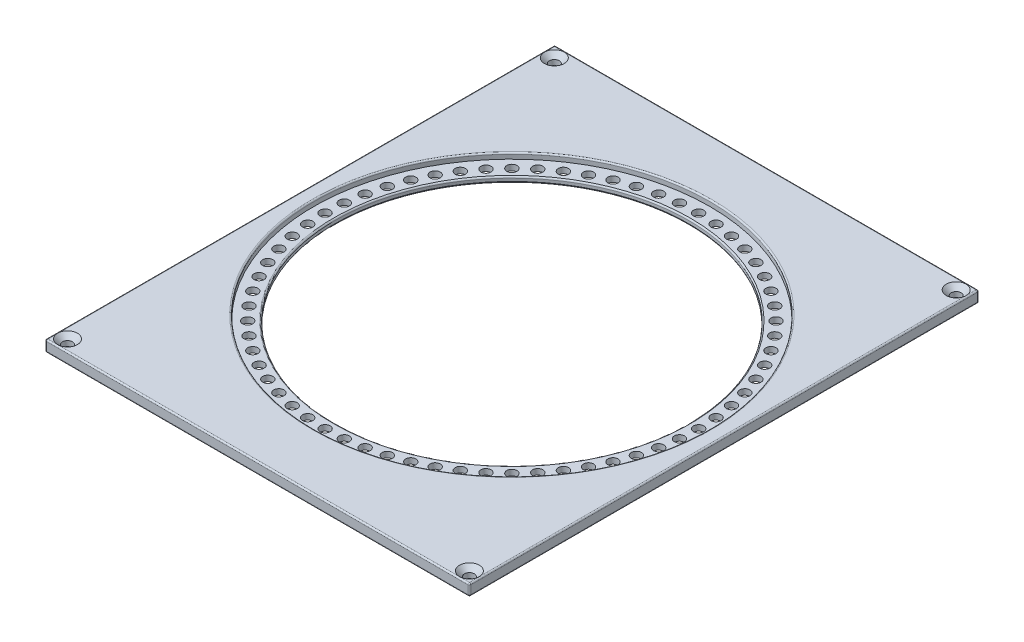
from build123d import *

# Parameters (mm, degrees)
SKETCH1_R           = 70
SKETCH1_R_2         = 62.5
SKETCH1_R_3         = 1.8
BOSS_EXTRUDE1_DEPTH = 2
SKETCH1_3_W         = 150
SKETCH1_3_H         = 180
SKETCH1_3_R         = 70
SKETCH1_3_R_2       = 1.75
BOSS_EXTRUDE2_DEPTH = 4
SKETCH2_W           = 180
SKETCH2_H           = 4
CUT_EXTRUDE1_DEPTH  = 0.1
CHAMFER1_SIZE       = 1.75
BOSS_EXTRUDE3_DEPTH = 2
FILLET1_R           = 0.5


with BuildPart() as part:
    # Sketch1 → Boss-Extrude1 (new body)
    with BuildSketch(Plane(origin=(0, 0, 0), x_dir=(1, 0, 0), z_dir=(0, 1, 0))):
        with Locations(Location((0, 0, 0), (0, 0, 270))):
            Circle(SKETCH1_R)
        with Locations(Location((0, 0, 0), (0, 0, 270))):
            Circle(SKETCH1_R_2, mode=Mode.SUBTRACT)
        with Locations(Location((46.669047558, -46.669047558, 0), (0, 0, 270))):
            Circle(SKETCH1_R_3, mode=Mode.SUBTRACT)
        with Locations(Location((41.869956755, -51.018689922, 0), (0, 0, 270))):
            Circle(SKETCH1_R_3, mode=Mode.SUBTRACT)
        with Locations(Location((36.667635379, -54.876994412, 0), (0, 0, 270))):
            Circle(SKETCH1_R_3, mode=Mode.SUBTRACT)
        with Locations(Location((31.112184631, -58.206803447, 0), (0, 0, 270))):
            Circle(SKETCH1_R_3, mode=Mode.SUBTRACT)
        with Locations(Location((25.257106536, -60.976049146, 0), (0, 0, 270))):
            Circle(SKETCH1_R_3, mode=Mode.SUBTRACT)
        with Locations(Location((19.158788699, -63.158062158, 0), (0, 0, 270))):
            Circle(SKETCH1_R_3, mode=Mode.SUBTRACT)
        with Locations(Location((12.875961253, -64.731828507, 0), (0, 0, 270))):
            Circle(SKETCH1_R_3, mode=Mode.SUBTRACT)
        with Locations(Location((6.469131262, -65.68219196, 0), (0, 0, 270))):
            Circle(SKETCH1_R_3, mode=Mode.SUBTRACT)
        with Locations(Location((0, -66, 0), (0, 0, 270))):
            Circle(SKETCH1_R_3, mode=Mode.SUBTRACT)
        with Locations(Location((-6.469131262, -65.68219196, 0), (0, 0, 270))):
            Circle(SKETCH1_R_3, mode=Mode.SUBTRACT)
        with Locations(Location((-12.875961253, -64.731828507, 0), (0, 0, 270))):
            Circle(SKETCH1_R_3, mode=Mode.SUBTRACT)
        with Locations(Location((-19.158788699, -63.158062158, 0), (0, 0, 270))):
            Circle(SKETCH1_R_3, mode=Mode.SUBTRACT)
        with Locations(Location((-25.257106536, -60.976049146, 0), (0, 0, 270))):
            Circle(SKETCH1_R_3, mode=Mode.SUBTRACT)
        with Locations(Location((-31.112184631, -58.206803447, 0), (0, 0, 270))):
            Circle(SKETCH1_R_3, mode=Mode.SUBTRACT)
        with Locations(Location((-36.667635379, -54.876994412, 0), (0, 0, 270))):
            Circle(SKETCH1_R_3, mode=Mode.SUBTRACT)
        with Locations(Location((-41.869956755, -51.018689922, 0), (0, 0, 270))):
            Circle(SKETCH1_R_3, mode=Mode.SUBTRACT)
        with Locations(Location((-46.669047558, -46.669047558, 0), (0, 0, 270))):
            Circle(SKETCH1_R_3, mode=Mode.SUBTRACT)
        with Locations(Location((-51.018689922, -41.869956755, 0), (0, 0, 270))):
            Circle(SKETCH1_R_3, mode=Mode.SUBTRACT)
        with Locations(Location((-54.876994412, -36.667635379, 0), (0, 0, 270))):
            Circle(SKETCH1_R_3, mode=Mode.SUBTRACT)
        with Locations(Location((-58.206803447, -31.112184631, 0), (0, 0, 270))):
            Circle(SKETCH1_R_3, mode=Mode.SUBTRACT)
        with Locations(Location((-60.976049146, -25.257106536, 0), (0, 0, 270))):
            Circle(SKETCH1_R_3, mode=Mode.SUBTRACT)
        with Locations(Location((-63.158062158, -19.158788699, 0), (0, 0, 270))):
            Circle(SKETCH1_R_3, mode=Mode.SUBTRACT)
        with Locations(Location((-64.731828507, -12.875961253, 0), (0, 0, 270))):
            Circle(SKETCH1_R_3, mode=Mode.SUBTRACT)
        with Locations(Location((-65.68219196, -6.469131262, 0), (0, 0, 270))):
            Circle(SKETCH1_R_3, mode=Mode.SUBTRACT)
        with Locations(Location((-66, 0, 0), (0, 0, 270))):
            Circle(SKETCH1_R_3, mode=Mode.SUBTRACT)
        with Locations(Location((-65.68219196, 6.469131262, 0), (0, 0, 270))):
            Circle(SKETCH1_R_3, mode=Mode.SUBTRACT)
        with Locations(Location((-64.731828507, 12.875961253, 0), (0, 0, 270))):
            Circle(SKETCH1_R_3, mode=Mode.SUBTRACT)
        with Locations(Location((-63.158062158, 19.158788699, 0), (0, 0, 270))):
            Circle(SKETCH1_R_3, mode=Mode.SUBTRACT)
        with Locations(Location((-60.976049146, 25.257106536, 0), (0, 0, 270))):
            Circle(SKETCH1_R_3, mode=Mode.SUBTRACT)
        with Locations(Location((-58.206803447, 31.112184631, 0), (0, 0, 270))):
            Circle(SKETCH1_R_3, mode=Mode.SUBTRACT)
        with Locations(Location((-54.876994412, 36.667635379, 0), (0, 0, 270))):
            Circle(SKETCH1_R_3, mode=Mode.SUBTRACT)
        with Locations(Location((-51.018689922, 41.869956755, 0), (0, 0, 270))):
            Circle(SKETCH1_R_3, mode=Mode.SUBTRACT)
        with Locations(Location((-46.669047558, 46.669047558, 0), (0, 0, 270))):
            Circle(SKETCH1_R_3, mode=Mode.SUBTRACT)
        with Locations(Location((-41.869956755, 51.018689922, 0), (0, 0, 270))):
            Circle(SKETCH1_R_3, mode=Mode.SUBTRACT)
        with Locations(Location((-36.667635379, 54.876994412, 0), (0, 0, 270))):
            Circle(SKETCH1_R_3, mode=Mode.SUBTRACT)
        with Locations(Location((-31.112184631, 58.206803447, 0), (0, 0, 270))):
            Circle(SKETCH1_R_3, mode=Mode.SUBTRACT)
        with Locations(Location((-25.257106536, 60.976049146, 0), (0, 0, 270))):
            Circle(SKETCH1_R_3, mode=Mode.SUBTRACT)
        with Locations(Location((-19.158788699, 63.158062158, 0), (0, 0, 270))):
            Circle(SKETCH1_R_3, mode=Mode.SUBTRACT)
        with Locations(Location((-12.875961253, 64.731828507, 0), (0, 0, 270))):
            Circle(SKETCH1_R_3, mode=Mode.SUBTRACT)
        with Locations(Location((-6.469131262, 65.68219196, 0), (0, 0, 270))):
            Circle(SKETCH1_R_3, mode=Mode.SUBTRACT)
        with Locations(Location((0, 66, 0), (0, 0, 270))):
            Circle(SKETCH1_R_3, mode=Mode.SUBTRACT)
        with Locations(Location((6.469131262, 65.68219196, 0), (0, 0, 270))):
            Circle(SKETCH1_R_3, mode=Mode.SUBTRACT)
        with Locations(Location((12.875961253, 64.731828507, 0), (0, 0, 270))):
            Circle(SKETCH1_R_3, mode=Mode.SUBTRACT)
        with Locations(Location((19.158788699, 63.158062158, 0), (0, 0, 270))):
            Circle(SKETCH1_R_3, mode=Mode.SUBTRACT)
        with Locations(Location((25.257106536, 60.976049146, 0), (0, 0, 270))):
            Circle(SKETCH1_R_3, mode=Mode.SUBTRACT)
        with Locations(Location((31.112184631, 58.206803447, 0), (0, 0, 270))):
            Circle(SKETCH1_R_3, mode=Mode.SUBTRACT)
        with Locations(Location((36.667635379, 54.876994412, 0), (0, 0, 270))):
            Circle(SKETCH1_R_3, mode=Mode.SUBTRACT)
        with Locations(Location((41.869956755, 51.018689922, 0), (0, 0, 270))):
            Circle(SKETCH1_R_3, mode=Mode.SUBTRACT)
        with Locations(Location((46.669047558, 46.669047558, 0), (0, 0, 270))):
            Circle(SKETCH1_R_3, mode=Mode.SUBTRACT)
        with Locations(Location((51.018689922, 41.869956755, 0), (0, 0, 270))):
            Circle(SKETCH1_R_3, mode=Mode.SUBTRACT)
        with Locations(Location((54.876994412, 36.667635379, 0), (0, 0, 270))):
            Circle(SKETCH1_R_3, mode=Mode.SUBTRACT)
        with Locations(Location((58.206803447, 31.112184631, 0), (0, 0, 270))):
            Circle(SKETCH1_R_3, mode=Mode.SUBTRACT)
        with Locations(Location((60.976049146, 25.257106536, 0), (0, 0, 270))):
            Circle(SKETCH1_R_3, mode=Mode.SUBTRACT)
        with Locations(Location((63.158062158, 19.158788699, 0), (0, 0, 270))):
            Circle(SKETCH1_R_3, mode=Mode.SUBTRACT)
        with Locations(Location((64.731828507, 12.875961253, 0), (0, 0, 270))):
            Circle(SKETCH1_R_3, mode=Mode.SUBTRACT)
        with Locations(Location((65.68219196, 6.469131262, 0), (0, 0, 270))):
            Circle(SKETCH1_R_3, mode=Mode.SUBTRACT)
        with Locations(Location((66, 0, 0), (0, 0, 270))):
            Circle(SKETCH1_R_3, mode=Mode.SUBTRACT)
        with Locations(Location((65.68219196, -6.469131262, 0), (0, 0, 270))):
            Circle(SKETCH1_R_3, mode=Mode.SUBTRACT)
        with Locations(Location((64.731828507, -12.875961253, 0), (0, 0, 270))):
            Circle(SKETCH1_R_3, mode=Mode.SUBTRACT)
        with Locations(Location((63.158062158, -19.158788699, 0), (0, 0, 270))):
            Circle(SKETCH1_R_3, mode=Mode.SUBTRACT)
        with Locations(Location((60.976049146, -25.257106536, 0), (0, 0, 270))):
            Circle(SKETCH1_R_3, mode=Mode.SUBTRACT)
        with Locations(Location((58.206803447, -31.112184631, 0), (0, 0, 270))):
            Circle(SKETCH1_R_3, mode=Mode.SUBTRACT)
        with Locations(Location((54.876994412, -36.667635379, 0), (0, 0, 270))):
            Circle(SKETCH1_R_3, mode=Mode.SUBTRACT)
        with Locations(Location((51.018689922, -41.869956755, 0), (0, 0, 270))):
            Circle(SKETCH1_R_3, mode=Mode.SUBTRACT)
    extrude(amount=BOSS_EXTRUDE1_DEPTH)

    # Sketch1<3> → Boss-Extrude2 (add)
    with BuildSketch(Plane(origin=(0, 0, 0), x_dir=(1, 0, 0), z_dir=(0, 1, 0))):
        Rectangle(SKETCH1_3_W, SKETCH1_3_H)
        with Locations(Location((0, 0, 0), (0, 0, 270))):
            Circle(SKETCH1_3_R, mode=Mode.SUBTRACT)
        with Locations(Location((-71, 86, 0), (0, 0, 270))):
            Circle(SKETCH1_3_R_2, mode=Mode.SUBTRACT)
        with Locations(Location((71, 86, 0), (0, 0, 270))):
            Circle(SKETCH1_3_R_2, mode=Mode.SUBTRACT)
        with Locations(Location((71, -86, 0), (0, 0, 270))):
            Circle(SKETCH1_3_R_2, mode=Mode.SUBTRACT)
        with Locations(Location((-71, -86, 0), (0, 0, 270))):
            Circle(SKETCH1_3_R_2, mode=Mode.SUBTRACT)
    extrude(amount=BOSS_EXTRUDE2_DEPTH)

    # Sketch2 → Cut-Extrude1 (cut)
    with BuildSketch(Plane.ZY.offset(75)):
        with Locations((0, 2)):
            Rectangle(SKETCH2_W, SKETCH2_H)
    extrude(amount=-CUT_EXTRUDE1_DEPTH, mode=Mode.SUBTRACT)

    # Chamfer1
    chamfer1_edges = [part.edges().sort_by_distance(p)[0] for p in [
        (-71, 4, -87.75),
        (71, 4, -87.75),
        (71, 4, 84.25),
        (-71, 4, 84.25),
    ]]
    chamfer(chamfer1_edges, length=CHAMFER1_SIZE)

    # Sketch1<4> → Boss-Extrude3 (add)
    with BuildSketch(Plane(origin=(0, 0, 0), x_dir=(1, 0, 0), z_dir=(0, 1, 0))):
        Polygon((-72.7, 0), (-72.7, 10), (-70.147780835, 10), (-70.147780835, -10), (-72.7, -10), align=None)
        Polygon((0, -87.7), (-10, -87.7), (-10, -85.7), (10, -85.7), (10, -87.7), align=None)
        Polygon((0, 87.7), (10, 87.7), (10, 85.7), (-10, 85.7), (-10, 87.7), align=None)
    extrude(amount=-BOSS_EXTRUDE3_DEPTH)

    # Fillet1
    # the kernel refuses this fillet: 0.5 mm, written as the material it takes off along each edge
    with BuildSketch(Plane(origin=(74.5, 3.5, 89.5), x_dir=(0, 0, 1), z_dir=(0, 1, 0))) as fillet1_piece_1_section:
        Polygon((0, 0), (FILLET1_R, 0), (FILLET1_R, FILLET1_R), (0, FILLET1_R), align=None)
    fillet1_piece_1 = extrude(amount=FILLET1_R, mode=Mode.PRIVATE)
    fillet1_piece_1 = fillet1_piece_1 - Plane(origin=(74.5, 3.5, 89.5), x_dir=(-0.7071067811865476, 0, -0.7071067811865476), z_dir=(0, 1, 0)) * Sphere(FILLET1_R, mode=Mode.PRIVATE)
    add(fillet1_piece_1, mode=Mode.SUBTRACT)
    with BuildSketch(Plane(origin=(-74.4, 3.5, 89.5), x_dir=(0, 0, 1), z_dir=(0, 1, 0))) as fillet1_piece_2_section:
        Polygon((0, 0), (FILLET1_R, 0), (FILLET1_R, -FILLET1_R), (0, -FILLET1_R), align=None)
    fillet1_piece_2 = extrude(amount=FILLET1_R, mode=Mode.PRIVATE)
    fillet1_piece_2 = fillet1_piece_2 - Plane(origin=(-74.4, 3.5, 89.5), x_dir=(0.7071067811865474, 0, -0.7071067811865476), z_dir=(0, 1, 0)) * Sphere(FILLET1_R, mode=Mode.PRIVATE)
    add(fillet1_piece_2, mode=Mode.SUBTRACT)
    with BuildSketch(Plane(origin=(74.5, 0.5, -89.5), x_dir=(1, 0, 0), z_dir=(0, -1, 0))) as fillet1_piece_3_section:
        Polygon((0, 0), (FILLET1_R, 0), (FILLET1_R, -FILLET1_R), (0, -FILLET1_R), align=None)
    fillet1_piece_3 = extrude(amount=FILLET1_R, mode=Mode.PRIVATE)
    fillet1_piece_3 = fillet1_piece_3 - Plane(origin=(74.5, 0.5, -89.5), x_dir=(-0.7071067811865477, 0, 0.7071067811865474), z_dir=(0, -1, 0)) * Sphere(FILLET1_R, mode=Mode.PRIVATE)
    add(fillet1_piece_3, mode=Mode.SUBTRACT)
    with BuildSketch(Plane(origin=(74.5, 0.5, 89.5), x_dir=(0, 0, 1), z_dir=(0, -1, 0))) as fillet1_piece_4_section:
        Polygon((0, 0), (FILLET1_R, 0), (FILLET1_R, -FILLET1_R), (0, -FILLET1_R), align=None)
    fillet1_piece_4 = extrude(amount=FILLET1_R, mode=Mode.PRIVATE)
    fillet1_piece_4 = fillet1_piece_4 - Plane(origin=(74.5, 0.5, 89.5), x_dir=(-0.7071067811865476, 0, -0.7071067811865476), z_dir=(0, -1, 0)) * Sphere(FILLET1_R, mode=Mode.PRIVATE)
    add(fillet1_piece_4, mode=Mode.SUBTRACT)
    with BuildSketch(Plane(origin=(-74.4, 0.5, -89.5), x_dir=(-1, 0, 0), z_dir=(0, -1, 0))) as fillet1_piece_5_section:
        Polygon((0, 0), (FILLET1_R, 0), (FILLET1_R, FILLET1_R), (0, FILLET1_R), align=None)
    fillet1_piece_5 = extrude(amount=FILLET1_R, mode=Mode.PRIVATE)
    fillet1_piece_5 = fillet1_piece_5 - Plane(origin=(-74.4, 0.5, -89.5), x_dir=(0.7071067811865475, 0, 0.7071067811865476), z_dir=(0, -1, 0)) * Sphere(FILLET1_R, mode=Mode.PRIVATE)
    add(fillet1_piece_5, mode=Mode.SUBTRACT)
    with BuildSketch(Plane(origin=(74.5, 3.5, -89.5), x_dir=(1, 0, 0), z_dir=(0, 1, 0))) as fillet1_piece_6_section:
        Polygon((0, 0), (FILLET1_R, 0), (FILLET1_R, FILLET1_R), (0, FILLET1_R), align=None)
    fillet1_piece_6 = extrude(amount=FILLET1_R, mode=Mode.PRIVATE)
    fillet1_piece_6 = fillet1_piece_6 - Plane(origin=(74.5, 3.5, -89.5), x_dir=(-0.7071067811865477, 0, 0.7071067811865474), z_dir=(0, 1, 0)) * Sphere(FILLET1_R, mode=Mode.PRIVATE)
    add(fillet1_piece_6, mode=Mode.SUBTRACT)
    with BuildSketch(Plane(origin=(-74.4, 0.5, 89.5), x_dir=(0, 0, 1), z_dir=(0, -1, 0))) as fillet1_piece_7_section:
        Polygon((0, 0), (FILLET1_R, 0), (FILLET1_R, FILLET1_R), (0, FILLET1_R), align=None)
    fillet1_piece_7 = extrude(amount=FILLET1_R, mode=Mode.PRIVATE)
    fillet1_piece_7 = fillet1_piece_7 - Plane(origin=(-74.4, 0.5, 89.5), x_dir=(0.7071067811865474, 0, -0.7071067811865476), z_dir=(0, -1, 0)) * Sphere(FILLET1_R, mode=Mode.PRIVATE)
    add(fillet1_piece_7, mode=Mode.SUBTRACT)
    with BuildSketch(Plane(origin=(-74.4, 3.5, -89.5), x_dir=(-1, 0, 0), z_dir=(0, 1, 0))) as fillet1_piece_8_section:
        Polygon((0, 0), (FILLET1_R, 0), (FILLET1_R, -FILLET1_R), (0, -FILLET1_R), align=None)
    fillet1_piece_8 = extrude(amount=FILLET1_R, mode=Mode.PRIVATE)
    fillet1_piece_8 = fillet1_piece_8 - Plane(origin=(-74.4, 3.5, -89.5), x_dir=(0.7071067811865475, 0, 0.7071067811865476), z_dir=(0, 1, 0)) * Sphere(FILLET1_R, mode=Mode.PRIVATE)
    add(fillet1_piece_8, mode=Mode.SUBTRACT)
    with BuildSketch(Plane(origin=(74.5, 4, 90), x_dir=(0, 0, -1), z_dir=(-1, 0, 0)), Plane(origin=(-74.4, 4, -90), x_dir=(0, 0, 1), z_dir=(1, 0, 0))) as fillet1_piece_9:
        with BuildLine():
            CenterArc((FILLET1_R, FILLET1_R), FILLET1_R, 180, 90)
            Line((0, FILLET1_R), (0, 0))
            Line((0, 0), (FILLET1_R, 0))
        make_face()
    extrude(amount=148.9, mode=Mode.SUBTRACT)
    with BuildSketch(Plane(origin=(75, 0, -89.5), x_dir=(-1, 0, 0), z_dir=(0, 0, 1)), Plane(origin=(-74.9, 4, -89.5), x_dir=(1, 0, 0), z_dir=(0, 0, 1)), Plane(origin=(-74.9, 0, 89.5), x_dir=(1, 0, 0), z_dir=(0, 0, -1))) as fillet1_piece_10:
        with BuildLine():
            CenterArc((FILLET1_R, -FILLET1_R), FILLET1_R, 90, 90)
            Line((0, -FILLET1_R), (0, 0))
            Line((0, 0), (FILLET1_R, 0))
        make_face()
    extrude(amount=179, mode=Mode.SUBTRACT)
    with BuildSketch(Plane(origin=(75, 0.5, 90), x_dir=(-1, 0, 0), z_dir=(0, 1, 0)), Plane(origin=(75, 0.5, -90), x_dir=(0, 0, 1), z_dir=(0, 1, 0)), Plane(origin=(-74.9, 3.5, 90), x_dir=(1, 0, 0), z_dir=(0, -1, 0))) as fillet1_piece_11:
        with BuildLine():
            CenterArc((FILLET1_R, -FILLET1_R), FILLET1_R, 90, 90)
            Line((0, -FILLET1_R), (0, 0))
            Line((0, 0), (FILLET1_R, 0))
        make_face()
    extrude(amount=3, mode=Mode.SUBTRACT)
    with BuildSketch(Plane(origin=(-74.4, 0, -90), x_dir=(0, 0, 1), z_dir=(1, 0, 0)), Plane(origin=(74.5, 0, 90), x_dir=(0, 0, -1), z_dir=(-1, 0, 0))) as fillet1_piece_12:
        with BuildLine():
            CenterArc((FILLET1_R, -FILLET1_R), FILLET1_R, 90, 90)
            Line((0, -FILLET1_R), (0, 0))
            Line((0, 0), (FILLET1_R, 0))
        make_face()
    extrude(amount=148.9, mode=Mode.SUBTRACT)
    with BuildSketch(Plane(origin=(0, 4, 0), x_dir=(0, 0, 1), z_dir=(-1, 0, 0))) as fillet1_piece_13:
        with BuildLine():
            CenterArc((70 + FILLET1_R, -FILLET1_R), FILLET1_R, 90, 90)
            Line((70, -FILLET1_R), (70, 0))
            Line((70, 0), (70 + FILLET1_R, 0))
        make_face()
    revolve(axis=Axis((0, 4, 0), (0, 1, 0)), mode=Mode.SUBTRACT)
    with BuildSketch(Plane(origin=(-71, 0, 86), x_dir=(0, 0, 1), z_dir=(-1, 0, 0))) as fillet1_piece_14:
        with BuildLine():
            CenterArc((1.75 + FILLET1_R, FILLET1_R), FILLET1_R, 180, 90)
            Line((1.75 + FILLET1_R, 0), (1.75, 0))
            Line((1.75, 0), (1.75, FILLET1_R))
        make_face()
    revolve(axis=Axis((-71, 0, 86), (0, 1, 0)), mode=Mode.SUBTRACT)
    with BuildSketch(Plane(origin=(71, 0, 86), x_dir=(0, 0, 1), z_dir=(-1, 0, 0))) as fillet1_piece_15:
        with BuildLine():
            CenterArc((1.75 + FILLET1_R, FILLET1_R), FILLET1_R, 180, 90)
            Line((1.75, FILLET1_R), (1.75, 0))
            Line((1.75, 0), (1.75 + FILLET1_R, 0))
        make_face()
    revolve(axis=Axis((71, 0, 86), (0, 1, 0)), mode=Mode.SUBTRACT)
    with BuildSketch(Plane(origin=(71, 0, -86), x_dir=(0, 0, 1), z_dir=(-1, 0, 0))) as fillet1_piece_16:
        with BuildLine():
            CenterArc((1.75 + FILLET1_R, FILLET1_R), FILLET1_R, 180, 90)
            Line((1.75, FILLET1_R), (1.75, 0))
            Line((1.75, 0), (1.75 + FILLET1_R, 0))
        make_face()
    revolve(axis=Axis((71, 0, -86), (0, 1, 0)), mode=Mode.SUBTRACT)
    with BuildSketch(Plane(origin=(-71, 0, -86), x_dir=(0, 0, 1), z_dir=(-1, 0, 0))) as fillet1_piece_17:
        with BuildLine():
            CenterArc((1.75 + FILLET1_R, FILLET1_R), FILLET1_R, 180, 90)
            Line((1.75, FILLET1_R), (1.75, 0))
            Line((1.75, 0), (1.75 + FILLET1_R, 0))
        make_face()
    revolve(axis=Axis((-71, 0, -86), (0, 1, 0)), mode=Mode.SUBTRACT)
    with BuildSketch(Plane(origin=(75, 4, -89.5), x_dir=(-1, 0, 0), z_dir=(0, 0, 1))) as fillet1_piece_18:
        with BuildLine():
            CenterArc((FILLET1_R, FILLET1_R), FILLET1_R, 180, 90)
            Line((0, FILLET1_R), (0, 0))
            Line((0, 0), (FILLET1_R, 0))
        make_face()
    extrude(amount=179, mode=Mode.SUBTRACT)
    with BuildSketch(Plane(origin=(-74.9, 0.5, -90), x_dir=(0, 0, 1), z_dir=(0, 1, 0))) as fillet1_piece_19:
        with BuildLine():
            CenterArc((FILLET1_R, FILLET1_R), FILLET1_R, 180, 90)
            Line((0, FILLET1_R), (0, 0))
            Line((0, 0), (FILLET1_R, 0))
        make_face()
    extrude(amount=3, mode=Mode.SUBTRACT)
    with BuildSketch(Plane(origin=(10, -2, -88.95), x_dir=(0, 1, 0), z_dir=(0, 0, 1)), Plane(origin=(-10, -2, -84.45), x_dir=(0, 1, 0), z_dir=(0, 0, -1)), Plane(origin=(-10, -2, 88.95), x_dir=(0, 1, 0), z_dir=(0, 0, -1)), Plane(origin=(10, -2, 84.45), x_dir=(0, 1, 0), z_dir=(0, 0, 1))) as fillet1_piece_20:
        with BuildLine():
            CenterArc((FILLET1_R, FILLET1_R), FILLET1_R, 180, 90)
            Line((0, FILLET1_R), (0, 0))
            Line((0, 0), (FILLET1_R, 0))
        make_face()
    extrude(amount=4.5, mode=Mode.SUBTRACT)
    with BuildSketch(Plane(origin=(11.25, -2, -85.7), x_dir=(0, 1, 0), z_dir=(-1, 0, 0)), Plane(origin=(-70.147780835, -2, -11.25), x_dir=(0, 1, 0), z_dir=(0, 0, 1)), Plane(origin=(-11.25, -2, 85.7), x_dir=(0, 1, 0), z_dir=(1, 0, 0))) as fillet1_piece_21:
        with BuildLine():
            CenterArc((FILLET1_R, FILLET1_R), FILLET1_R, 180, 90)
            Line((0, FILLET1_R), (0, 0))
            Line((0, 0), (FILLET1_R, 0))
        make_face()
    extrude(amount=22.5, mode=Mode.SUBTRACT)
    with BuildSketch(Plane(origin=(11.25, -2, -87.7), x_dir=(0, 1, 0), z_dir=(-1, 0, 0)), Plane(origin=(-72.7, -2, -11.25), x_dir=(0, 1, 0), z_dir=(0, 0, 1)), Plane(origin=(-11.25, -2, 87.7), x_dir=(0, 1, 0), z_dir=(1, 0, 0))) as fillet1_piece_22:
        with BuildLine():
            CenterArc((FILLET1_R, -FILLET1_R), FILLET1_R, 90, 90)
            Line((0, -FILLET1_R), (0, 0))
            Line((0, 0), (FILLET1_R, 0))
        make_face()
    extrude(amount=22.5, mode=Mode.SUBTRACT)
    with BuildSketch(Plane(origin=(-68.897780835, -2, 10), x_dir=(0, 1, 0), z_dir=(-1, 0, 0)), Plane(origin=(-73.95, -2, -10), x_dir=(0, 1, 0), z_dir=(1, 0, 0))) as fillet1_piece_23:
        with BuildLine():
            CenterArc((FILLET1_R, FILLET1_R), FILLET1_R, 180, 90)
            Line((0, FILLET1_R), (0, 0))
            Line((0, 0), (FILLET1_R, 0))
        make_face()
    extrude(amount=5.052219165, mode=Mode.SUBTRACT)
    with BuildSketch(Plane(origin=(0, 2, 0), x_dir=(0, 0, 1), z_dir=(-1, 0, 0))) as fillet1_piece_24:
        with BuildLine():
            CenterArc((62.5 + FILLET1_R, -FILLET1_R), FILLET1_R, 90, 90)
            Line((62.5 + FILLET1_R, 0), (62.5, 0))
            Line((62.5, 0), (62.5, -FILLET1_R))
        make_face()
    revolve(axis=Axis((0, 2, 0), (0, 1, 0)), mode=Mode.SUBTRACT)
    with BuildSketch(Plane(origin=(0, 0, 0), x_dir=(0, 0, 1), z_dir=(-1, 0, 0))) as fillet1_piece_25:
        with BuildLine():
            CenterArc((62.5 + FILLET1_R, FILLET1_R), FILLET1_R, 180, 90)
            Line((62.5, FILLET1_R), (62.5, 0))
            Line((62.5, 0), (62.5 + FILLET1_R, 0))
        make_face()
    revolve(axis=Axis((0, 0, 0), (0, 1, 0)), mode=Mode.SUBTRACT)


solid = part.part
